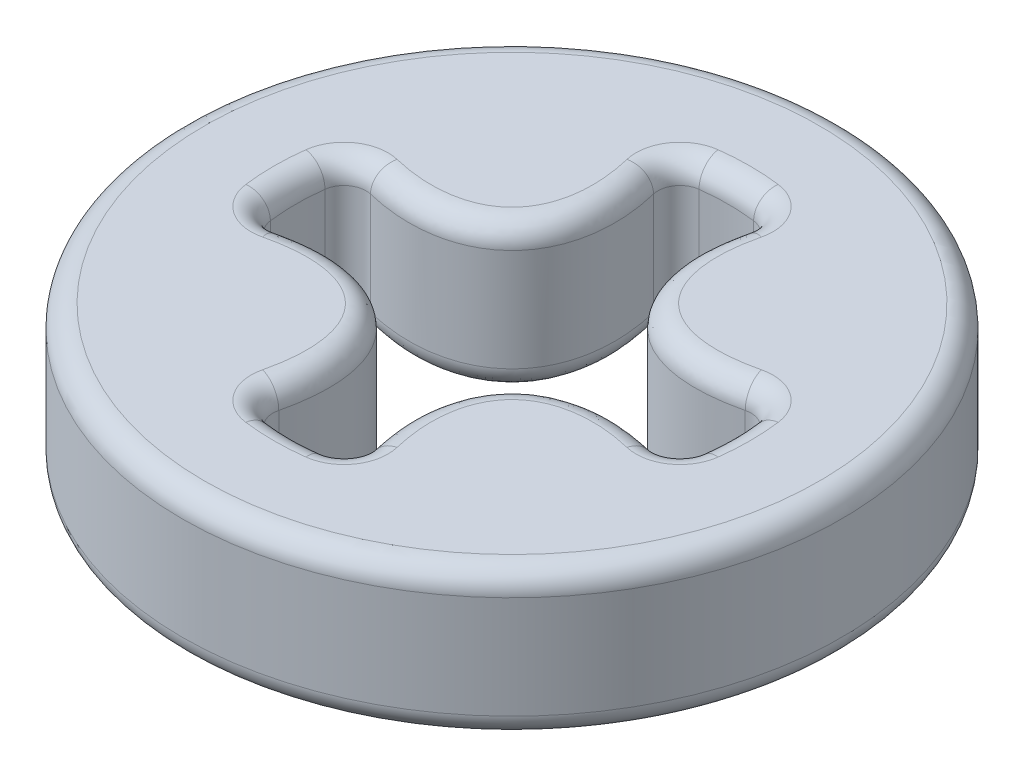
from build123d import *

# Parameters (mm, degrees)
SKETCH4_R           = 4.5
BOSS_EXTRUDE3_DEPTH = 2
CUT_EXTRUDE2_DEPTH  = 2
FILLET1_R           = 0.3


with BuildPart() as part:
    # Sketch4 → Boss-Extrude3 (new body)
    with BuildSketch(Plane(origin=(0, 0, 0), x_dir=(1, 0, 0), z_dir=(0, 1, 0))):
        Circle(SKETCH4_R)
    extrude(amount=BOSS_EXTRUDE3_DEPTH)

    # Sketch3 → Cut-Extrude2 (cut)
    with BuildSketch(Plane(origin=(0, 0, 0), x_dir=(1, 0, 0), z_dir=(0, 1, 0))):
        with BuildLine():
            ThreePointArc((0.715181817, 2.861994928), (0, 2.95), (-0.715181817, 2.861994928))
            add(Edge.make_bspline(
                [(-2.861994928, 0.715181817), (0.401402999, -0.401402999), (-0.715181817, 2.861994928)],
                knots=[2.279796751, 2.279796751, 2.279796751, 4.003388556, 4.003388556, 4.003388556], degree=2, weights=[1, 0.651075405, 1]))
            ThreePointArc((-2.861994928, 0.715181817), (-2.95, 0), (-2.861994928, -0.715181817))
            add(Edge.make_bspline(
                [(-0.715181817, -2.861994928), (0.401402999, 0.401402999), (-2.861994928, -0.715181817)],
                knots=[2.279796751, 2.279796751, 2.279796751, 4.003388556, 4.003388556, 4.003388556], degree=2, weights=[1, 0.651075405, 1]))
            ThreePointArc((-0.715181817, -2.861994928), (0, -2.95), (0.715181817, -2.861994928))
            add(Edge.make_bspline(
                [(2.861994928, -0.715181817), (-0.401402999, 0.401402999), (0.715181817, -2.861994928)],
                knots=[2.279796751, 2.279796751, 2.279796751, 4.003388556, 4.003388556, 4.003388556], degree=2, weights=[1, 0.651075405, 1]))
            ThreePointArc((2.861994928, -0.715181817), (2.95, 0), (2.861994928, 0.715181817))
            add(Edge.make_bspline(
                [(0.715181817, 2.861994928), (-0.401402999, -0.401402999), (2.861994928, 0.715181817)],
                knots=[2.279796751, 2.279796751, 2.279796751, 4.003388556, 4.003388556, 4.003388556], degree=2, weights=[1, 0.651075405, 1]))
        make_face()
    extrude(amount=CUT_EXTRUDE2_DEPTH, mode=Mode.SUBTRACT)

    # Fillet1
    fillet1_edges = [part.edges().sort_by_distance(p)[0] for p in [
        (0, 0, 2.95),
        (-0.924775828, 0, 0.925224237),
        (0.925224237, 2, 0.924775828),
        (0.925224237, 0, 0.924775828),
        (-2.95, 0, 0),
        (-2.95, 2, 0),
        (0, 2, 2.95),
        (2.95, 2, 0),
        (2.95, 0, 0),
        (0, 2, -2.95),
        (0, 0, -2.95),
        (-4.5, 0, 0),
        (-2.861994928, 1, -0.715181817),
        (-2.861994928, 1, 0.715181817),
        (-0.715181817, 1, 2.861994928),
        (0.715181817, 1, 2.861994928),
        (2.861994928, 1, 0.715181817),
        (2.861994928, 1, -0.715181817),
        (0.715181817, 1, -2.861994928),
        (-0.715181817, 1, -2.861994928),
        (-0.925224237, 0, -0.924775828),
        (-0.925224237, 2, -0.924775828),
        (0.924775828, 2, -0.925224237),
        (0.924775828, 0, -0.925224237),
        (-0.924775828, 2, 0.925224237),
        (-4.5, 2, 0),
    ]]
    fillet(fillet1_edges, radius=FILLET1_R)


solid = part.part
